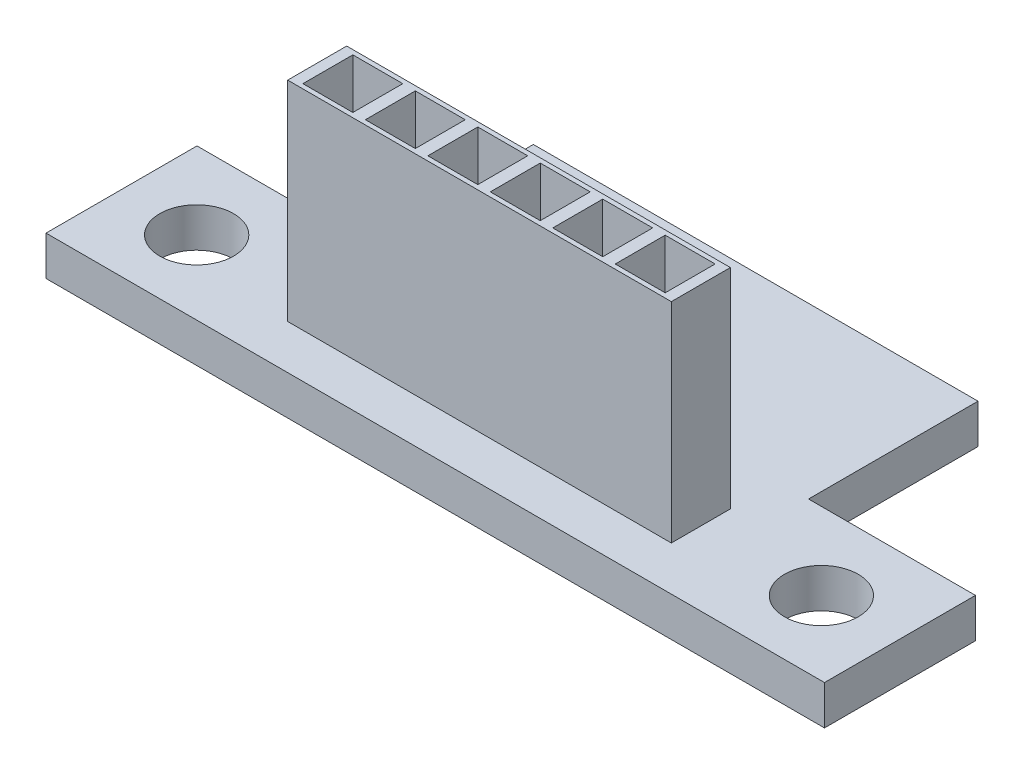
from build123d import *

# Parameters (mm, degrees)
SKETCH1_W           = 31.653368692
SKETCH1_H           = 13.02888101
BOSS_EXTRUDE1_DEPTH = 1.6
SKETCH2_W           = 15.6
SKETCH2_H           = 2.4
BOSS_EXTRUDE2_DEPTH = 8.5
SKETCH2_3_R         = 1.5
CUT_EXTRUDE2_DEPTH  = 20.109470754
SKETCH3_W           = 2.030267254
SKETCH3_H           = 2.030267255
CUT_EXTRUDE1_DEPTH  = 8
SKETCH4_W           = 6.78672069
SKETCH4_H           = 6.889802318
CUT_EXTRUDE3_DEPTH  = 20.109470754


with BuildPart() as part:
    # Sketch1 → Boss-Extrude1 (new body)
    with BuildSketch(Plane(origin=(0, 0, 0), x_dir=(1, 0, 0), z_dir=(0, 1, 0))):
        Rectangle(SKETCH1_W, SKETCH1_H)
    extrude(amount=BOSS_EXTRUDE1_DEPTH)

    # Sketch2<3> → Cut-Extrude2 (cut, through all)
    with BuildSketch(Plane(origin=(0, 1.6, 0), x_dir=(1, 0, 0), z_dir=(0, 1, 0))):
        with Locations((-12.7, -3.514440505)):
            Circle(SKETCH2_3_R)
        with Locations((12.7, -3.514440505)):
            Circle(SKETCH2_3_R)
    extrude(amount=-CUT_EXTRUDE2_DEPTH, mode=Mode.SUBTRACT)

    # Sketch4 → Cut-Extrude3 (cut, through all)
    with BuildSketch(Plane(origin=(0, 1.6, 0), x_dir=(1, 0, 0), z_dir=(0, 1, 0))):
        with Locations((-12.433324001, 3.069539346)):
            Rectangle(SKETCH4_W, SKETCH4_H)
        with Locations((12.433324001, 3.069539346)):
            Rectangle(SKETCH4_W, SKETCH4_H)
    extrude(amount=-CUT_EXTRUDE3_DEPTH, mode=Mode.SUBTRACT)


with BuildPart() as body_2:
    # Sketch2 → Boss-Extrude2 (new body)
    with BuildSketch(Plane(origin=(0, 1.6, 0), x_dir=(1, 0, 0), z_dir=(0, 1, 0))):
        with Locations((0, -3.514440505)):
            Rectangle(SKETCH2_W, SKETCH2_H)
    extrude(amount=BOSS_EXTRUDE2_DEPTH)

    # Sketch3 → Cut-Extrude1 (cut)
    with BuildSketch(Plane(origin=(0, 10.1, 0), x_dir=(1, 0, 0), z_dir=(0, 1, 0))):
        with Locations((-3.81, -3.514440505)):
            Rectangle(SKETCH3_W, SKETCH3_H)
        with Locations((-6.35, -3.514440505)):
            Rectangle(SKETCH3_W, SKETCH3_H)
        with Locations((-1.27, -3.514440505)):
            Rectangle(SKETCH3_W, SKETCH3_H)
        with Locations((1.27, -3.514440505)):
            Rectangle(SKETCH3_W, SKETCH3_H)
        with Locations((3.81, -3.514440505)):
            Rectangle(SKETCH3_W, SKETCH3_H)
        with Locations((6.35, -3.514440505)):
            Rectangle(SKETCH3_W, SKETCH3_H)
    extrude(amount=-CUT_EXTRUDE1_DEPTH, mode=Mode.SUBTRACT)


solid = Compound([part.part, body_2.part])
